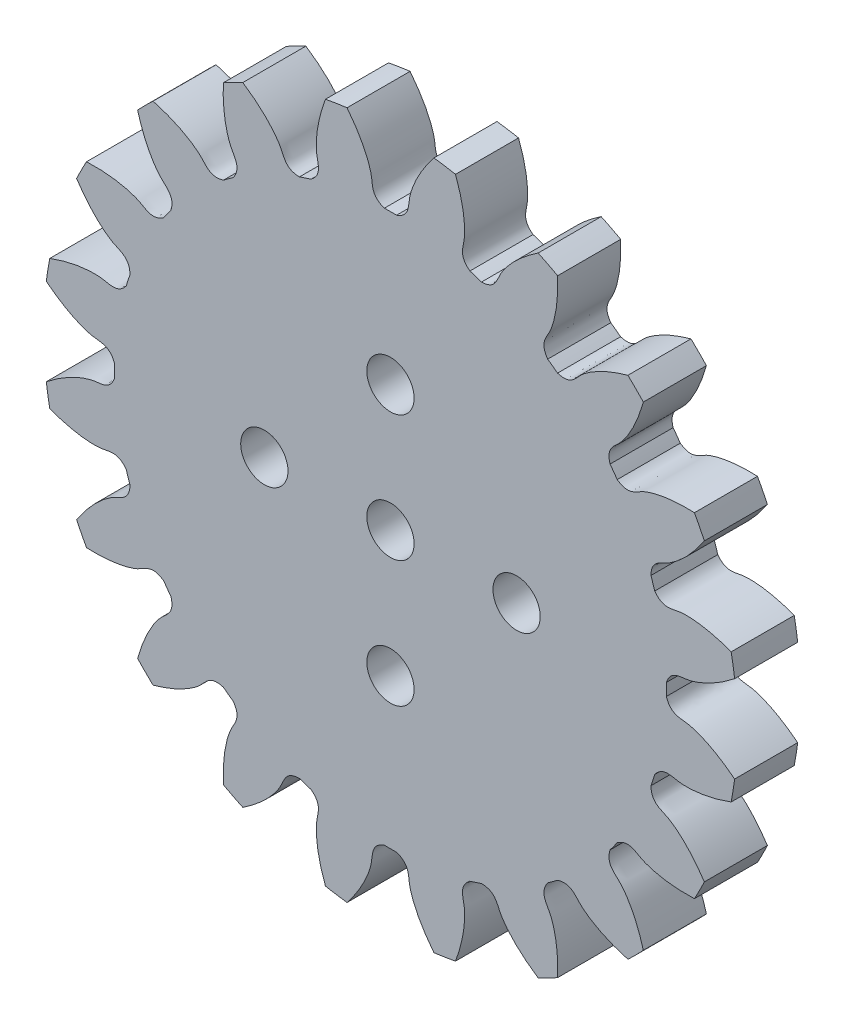
from build123d import *

# Parameters (mm, degrees)
SKETCH_1_R               = 22
EXTRUDE_1_DEPTH          = 4
CUT_EXTRUDE_1_DEPTH      = 32.368774283
PATTERN_CIRCULAR_1_COUNT = 20
SKETCH_4_R               = 1.5
CUT_EXTRUDE_2_DEPTH      = 10


with BuildPart() as part:
    # 草图1 → 凸台-拉伸1 (new body)
    with BuildSketch(Plane.XY):
        Circle(SKETCH_1_R)
    extrude(amount=EXTRUDE_1_DEPTH)

    # 草图2 → 切除-拉伸1 (cut, through all)
    with BuildSketch(Plane.XY):
        with BuildLine():
            ThreePointArc((0.386633201, 17.495728472), (0, 17.5), (-0.386633201, 17.495728472))
            add(Edge.make_bspline(
                [(-0.386633201, 17.495728472), (-1.22237881, 17.786951024), (-1.114168199, 18.374227398), (-1.225794113, 18.940018805), (-1.237784373, 18.995113228), (-1.25262178, 19.05726923), (-1.270584194, 19.126393672), (-1.29195828, 19.202382994), (-1.31702411, 19.285125656), (-1.346059743, 19.374501466), (-1.3793395, 19.470381894), (-1.4171342, 19.57263009), (-1.459710797, 19.681101001), (-1.507332204, 19.795641461), (-1.560257063, 19.916090303), (-1.618739529, 20.042278463), (-1.683029067, 20.174029102), (-1.753370234, 20.311157723), (-1.830002477, 20.4534723), (-1.913159931, 20.600773408), (-2.003071219, 20.752854362), (-2.099959252, 20.909501356), (-2.204041043, 21.070493611), (-2.315527511, 21.235603527), (-2.434623302, 21.404596841), (-2.561526601, 21.577232781), (-2.696428961, 21.753264241), (-2.839515123, 21.932437945), (-2.990962853, 22.114494623), (-3.15094277, 22.299169189), (-3.319618193, 22.486190926), (-3.497144978, 22.67528367), (-3.683671369, 22.866166005), (-3.879337852, 23.058551454), (-4.084277013, 23.252148679), (-4.298613397, 23.446661685), (-4.522463379, 23.641790022), (-4.755935037, 23.837228999), (-4.999128023, 24.032669892), (-5.252133469, 24.227800163), (-5.515033799, 24.42230368), (-5.882947182, 24.683279735), (-6.167864825, 24.872665202), (-6.362315964, 24.996503719)],
                knots=[0, 0, 0, 0, 0.165916003, 0.170905922, 0.176663519, 0.183188797, 0.190481754, 0.198542391, 0.207370708, 0.216966704, 0.22733038, 0.238461736, 0.250360771, 0.263027487, 0.276461881, 0.290663956, 0.30563371, 0.321371144, 0.337876258, 0.355149051, 0.373189524, 0.391997677, 0.411573509, 0.431917021, 0.453028213, 0.474907084, 0.497553636, 0.520967867, 0.545149777, 0.570099367, 0.595816637, 0.622301587, 0.649554216, 0.677574526, 0.706362514, 0.735918183, 0.766241531, 0.797332559, 0.829191267, 0.861817654, 0.895211721, 0.929373468, 1, 1, 1, 1], degree=3))
            ThreePointArc((-6.362315964, 24.996503719), (0, 25.793492641), (6.362315964, 24.996503719))
            add(Edge.make_bspline(
                [(0.386633201, 17.495728472), (1.22237881, 17.786951024), (1.114168199, 18.374227398), (1.225794113, 18.940018805), (1.237784373, 18.995113228), (1.25262178, 19.05726923), (1.270584194, 19.126393672), (1.29195828, 19.202382994), (1.31702411, 19.285125656), (1.346059743, 19.374501466), (1.3793395, 19.470381894), (1.4171342, 19.57263009), (1.459710797, 19.681101001), (1.507332204, 19.795641461), (1.560257063, 19.916090303), (1.618739529, 20.042278463), (1.683029067, 20.174029102), (1.753370234, 20.311157723), (1.830002477, 20.4534723), (1.913159931, 20.600773408), (2.003071219, 20.752854362), (2.099959252, 20.909501356), (2.204041043, 21.070493611), (2.315527511, 21.235603527), (2.434623302, 21.404596841), (2.561526601, 21.577232781), (2.696428961, 21.753264241), (2.839515123, 21.932437945), (2.990962853, 22.114494623), (3.15094277, 22.299169189), (3.319618193, 22.486190926), (3.497144978, 22.67528367), (3.683671369, 22.866166005), (3.879337852, 23.058551454), (4.084277013, 23.252148679), (4.298613397, 23.446661685), (4.522463379, 23.641790022), (4.755935037, 23.837228999), (4.999128023, 24.032669892), (5.252133469, 24.227800163), (5.515033799, 24.42230368), (5.882947182, 24.683279735), (6.167864825, 24.872665202), (6.362315964, 24.996503719)],
                knots=[0, 0, 0, 0, 0.165916003, 0.170905922, 0.176663519, 0.183188797, 0.190481754, 0.198542391, 0.207370708, 0.216966704, 0.22733038, 0.238461736, 0.250360771, 0.263027487, 0.276461881, 0.290663956, 0.30563371, 0.321371144, 0.337876258, 0.355149051, 0.373189524, 0.391997677, 0.411573509, 0.431917021, 0.453028213, 0.474907084, 0.497553636, 0.520967867, 0.545149777, 0.570099367, 0.595816637, 0.622301587, 0.649554216, 0.677574526, 0.706362514, 0.735918183, 0.766241531, 0.797332559, 0.829191267, 0.861817654, 0.895211721, 0.929373468, 1, 1, 1, 1], degree=3))
        make_face()
    cut_extrude_1 = extrude(amount=CUT_EXTRUDE_1_DEPTH, mode=Mode.SUBTRACT)

    # 阵列(圆周)1: 切除-拉伸1 ×20 about axis
    pattern_circular_1_axis = Axis((0, 0, -1.5), (0, 0, 1))
    for i in range(1, PATTERN_CIRCULAR_1_COUNT):
        add(cut_extrude_1.rotate(pattern_circular_1_axis, i * 360 / PATTERN_CIRCULAR_1_COUNT), mode=Mode.SUBTRACT)

    # 草图4 → 切除-拉伸2 (cut)
    with BuildSketch(Plane.XY.offset(4)):
        with Locations((0, 8)):
            Circle(SKETCH_4_R)
        with Locations((8, 0)):
            Circle(SKETCH_4_R)
        with Locations((-8, 0)):
            Circle(SKETCH_4_R)
        with Locations((0, -8)):
            Circle(SKETCH_4_R)
        Circle(SKETCH_4_R)
    extrude(amount=-CUT_EXTRUDE_2_DEPTH, mode=Mode.SUBTRACT)


solid = part.part
